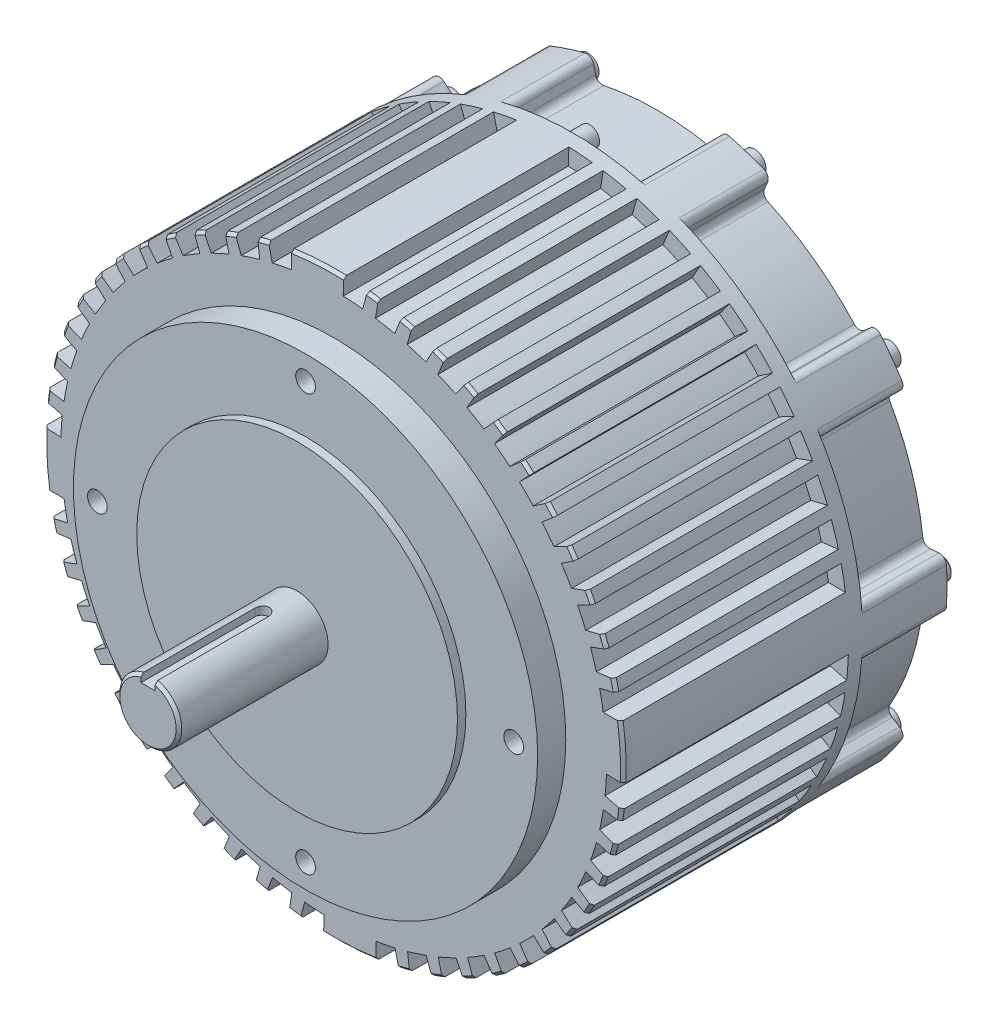
from build123d import *

# Parameters (mm, degrees)
CROQUIS1_W                        = 103
CROQUIS1_H                        = 115
CROQUIS2_R                        = 82.5
SALIENTE_EXTRUIR1_DEPTH           = 10
CROQUIS3_R                        = 57
SALIENTE_EXTRUIR2_DEPTH           = 3
CROQUIS4_R                        = 11
SALIENTE_EXTRUIR3_DEPTH           = 53
CORTAR_EXTRUIR1_START             = 8
CORTAR_EXTRUIR1_DEPTH             = 4
CORTAR_EXTRUIR2_START             = -30
CORTAR_EXTRUIR2_DEPTH             = 30
CROQUIS7_R                        = 3.5
SALIENTE_EXTRUIR4_DEPTH           = 6
CORTAR_EXTRUIR3_DEPTH             = 3
CORTAR_EXTRUIR4_START             = -30
CORTAR_EXTRUIR4_DEPTH             = 30
CROQUIS10_R                       = 3.5
SALIENTE_EXTRUIR5_DEPTH           = 6
CORTAR_EXTRUIR5_DEPTH             = 3
CROQUIS12_R                       = 4
SALIENTE_EXTRUIR6_DEPTH           = 5
CORTAR_EXTRUIR6_DEPTH             = 3
CROQUIS14_R                       = 4
SALIENTE_EXTRUIR7_DEPTH           = 5
CORTAR_EXTRUIR7_DEPTH             = 3
CROQUIS16_R                       = 4
SALIENTE_EXTRUIR8_DEPTH           = 5
CORTAR_EXTRUIR8_DEPTH             = 3
CROQUIS18_R                       = 4
SALIENTE_EXTRUIR9_DEPTH           = 5
CORTAR_EXTRUIR9_DEPTH             = 3
CROQUIS20_R                       = 4
SALIENTE_EXTRUIR10_DEPTH          = 5
CORTAR_EXTRUIR10_DEPTH            = 3
CROQUIS22_R                       = 4
SALIENTE_EXTRUIR11_DEPTH          = 5
CORTAR_EXTRUIR11_DEPTH            = 3
CROQUIS24_R                       = 4
SALIENTE_EXTRUIR12_DEPTH          = 5
CORTAR_EXTRUIR12_DEPTH            = 3
CROQUIS26_R                       = 4
SALIENTE_EXTRUIR13_DEPTH          = 5
CORTAR_EXTRUIR13_DEPTH            = 3
CROQUIS28_R                       = 4
SALIENTE_EXTRUIR14_DEPTH          = 5
CORTAR_EXTRUIR14_DEPTH            = 3
CORTAR_EXTRUIR15_DEPTH            = 80
CORTAR_EXTRUIR16_DEPTH            = 80
CORTAR_EXTRUIR17_DEPTH            = 80
CORTAR_EXTRUIR18_DEPTH            = 80
CORTAR_EXTRUIR19_DEPTH            = 80
CORTAR_EXTRUIR20_DEPTH            = 80
CORTAR_EXTRUIR21_DEPTH            = 80
CORTAR_EXTRUIR22_DEPTH            = 80
CORTAR_EXTRUIR23_DEPTH            = 80
CORTAR_EXTRUIR24_DEPTH            = 80
CORTAR_EXTRUIR25_DEPTH            = 80
CORTAR_EXTRUIR26_DEPTH            = 80
CORTAR_EXTRUIR27_DEPTH            = 80
CORTAR_EXTRUIR28_DEPTH            = 80
CORTAR_EXTRUIR29_DEPTH            = 80
CORTAR_EXTRUIR30_DEPTH            = 80
CORTAR_EXTRUIR31_DEPTH            = 80
CORTAR_EXTRUIR32_DEPTH            = 80
CORTAR_EXTRUIR33_DEPTH            = 80
CORTAR_EXTRUIR34_DEPTH            = 80
CORTAR_EXTRUIR35_DEPTH            = 80
CORTAR_EXTRUIR36_DEPTH            = 80
CORTAR_EXTRUIR37_DEPTH            = 80
CORTAR_EXTRUIR38_DEPTH            = 80
CORTAR_EXTRUIR39_DEPTH            = 80
CORTAR_EXTRUIR40_DEPTH            = 80
CORTAR_EXTRUIR41_DEPTH            = 80
CORTAR_EXTRUIR42_DEPTH            = 80
CORTAR_EXTRUIR43_DEPTH            = 80
CORTAR_EXTRUIR44_DEPTH            = 80
CORTAR_EXTRUIR45_DEPTH            = 80
CORTAR_EXTRUIR46_DEPTH            = 80
CORTAR_EXTRUIR47_DEPTH            = 80
CORTAR_EXTRUIR48_DEPTH            = 80
CORTAR_EXTRUIR49_DEPTH            = 80
CORTAR_EXTRUIR50_DEPTH            = 80
CORTAR_EXTRUIR51_DEPTH            = 80
CORTAR_EXTRUIR52_DEPTH            = 80
CORTAR_EXTRUIR53_DEPTH            = 80
CORTAR_EXTRUIR54_DEPTH            = 80
CORTAR_EXTRUIR55_DEPTH            = 80
CORTAR_EXTRUIR56_DEPTH            = 80
CORTAR_EXTRUIR57_DEPTH            = 80
CORTAR_EXTRUIR58_DEPTH            = 80
CORTAR_EXTRUIR59_DEPTH            = 80
CORTAR_EXTRUIR60_DEPTH            = 80
CORTAR_EXTRUIR61_DEPTH            = 80
CORTAR_EXTRUIR62_DEPTH            = 80
CORTAR_EXTRUIR63_START            = -30
CORTAR_EXTRUIR63_DEPTH            = 30
CORTAR_EXTRUIR64_START            = -30
CORTAR_EXTRUIR64_DEPTH            = 30
CORTAR_EXTRUIR65_START            = -30
CORTAR_EXTRUIR65_DEPTH            = 30
CORTAR_EXTRUIR66_START            = -30
CORTAR_EXTRUIR66_DEPTH            = 30
CORTAR_EXTRUIR67_START            = -30
CORTAR_EXTRUIR67_DEPTH            = 30
CORTAR_EXTRUIR68_START            = -30
CORTAR_EXTRUIR68_DEPTH            = 30
CORTAR_EXTRUIR69_START            = -30
CORTAR_EXTRUIR69_DEPTH            = 30
CORTAR_EXTRUIR70_START            = -30
CORTAR_EXTRUIR70_DEPTH            = 30
CROQUIS86_R                       = 4
SALIENTE_EXTRUIR15_DEPTH          = 5
CORTAR_EXTRUIR71_DEPTH            = 3
DI_METRO_DE_TALADRO_7_0_7_1_D     = 7
DI_METRO_DE_TALADRO_7_0_7_1_DEPTH = 21
DI_METRO_DE_TALADRO_7_0_7_1_TIP   = 2.103012167
CHAFL_N1_SIZE                     = 1
CHAFL_N2_SIZE                     = 0.5
REDONDEO1_R                       = 2.5


with BuildPart() as part:
    # Croquis1 → Revolución1 (revolve)
    with BuildSketch(Plane.XZ, mode=Mode.PRIVATE) as revoluci_n1_sk:
        with Locations((51.5, 57.5)):
            Rectangle(CROQUIS1_W, CROQUIS1_H)
    revolve(revoluci_n1_sk.sketch.rotate(Axis((0, 0, 115), (0, 0, -1)), 180), axis=Axis((0, 0, 115), (0, 0, -1)))

    # Croquis2 → Saliente-Extruir1 (add)
    with BuildSketch(Plane.XY.offset(115)):
        Circle(CROQUIS2_R)
    extrude(amount=SALIENTE_EXTRUIR1_DEPTH)

    # Croquis3 → Saliente-Extruir2 (add)
    with BuildSketch(Plane.XY.offset(125)):
        Circle(CROQUIS3_R)
    extrude(amount=SALIENTE_EXTRUIR2_DEPTH)

    # Croquis4 → Saliente-Extruir3 (add)
    with BuildSketch(Plane.XY.offset(128)):
        Circle(CROQUIS4_R)
    extrude(amount=SALIENTE_EXTRUIR3_DEPTH)

    # Cortar-Extruir1: read off the stored shape, not the designer's step
    # Cortar-Extruir1 outline → Cortar-Extruir1 (cut)
    with BuildSketch(Plane(origin=(0, 0, 0), x_dir=(1, 0, 0), z_dir=(0, 1, 0)).offset(CORTAR_EXTRUIR1_START)):
        with BuildLine():
            Line((-2.5, -181), (2.5, -181))
            Line((2.5, -181), (2.5, -140.5))
            ThreePointArc((2.5, -140.5), (0, -138), (-2.5, -140.5))
            Line((-2.5, -140.5), (-2.5, -181))
        make_face()
    extrude(amount=CORTAR_EXTRUIR1_DEPTH, mode=Mode.SUBTRACT)

    # Croquis6 → Cortar-Extruir2 (cut)
    with BuildSketch(Plane(origin=(0, 0, 0), x_dir=(-1, 0, 0), z_dir=(0, 0, -1)).offset(CORTAR_EXTRUIR2_START)):
        with BuildLine():
            Line((23.169958597, -100.360116673), (21.370350163, -92.565156155))
            ThreePointArc((21.370350163, -92.565156155), (0, -95), (-21.370350163, -92.565156155))
            Line((-21.370350163, -92.565156155), (-23.169958597, -100.360116673))
            ThreePointArc((-23.169958597, -100.360116673), (0, -103), (23.169958597, -100.360116673))
        make_face()
    extrude(amount=CORTAR_EXTRUIR2_DEPTH, mode=Mode.SUBTRACT)

    # Croquis7 → Saliente-Extruir4 (add)
    with BuildSketch(Plane(origin=(0, 0, 30), x_dir=(-1, 0, 0), z_dir=(0, 0, -1))):
        with Locations((0, -99)):
            Circle(CROQUIS7_R)
    extrude(amount=SALIENTE_EXTRUIR4_DEPTH)

    # Croquis8 → Cortar-Extruir3 (cut)
    with BuildSketch(Plane(origin=(0, 0, 24), x_dir=(-1, 0, 0), z_dir=(0, 0, -1))):
        Polygon((-1.933077268, -100.116062681), (0, -101.232125362), (1.933077268, -100.116062681), (1.933077268, -97.883937319), (0, -96.767874638), (-1.933077268, -97.883937319), align=None)
    extrude(amount=-CORTAR_EXTRUIR3_DEPTH, mode=Mode.SUBTRACT)

    # Croquis9 → Cortar-Extruir4 (cut)
    with BuildSketch(Plane(origin=(0, 0, 0), x_dir=(-1, 0, 0), z_dir=(0, 0, -1)).offset(CORTAR_EXTRUIR4_START)):
        with BuildLine():
            Line((-23.169958597, 100.360116673), (-21.370350163, 92.565156155))
            ThreePointArc((-21.370350163, 92.565156155), (0, 95), (21.370350163, 92.565156155))
            Line((21.370350163, 92.565156155), (23.169958597, 100.360116673))
            ThreePointArc((23.169958597, 100.360116673), (0, 103), (-23.169958597, 100.360116673))
        make_face()
    extrude(amount=CORTAR_EXTRUIR4_DEPTH, mode=Mode.SUBTRACT)

    # Croquis10 → Saliente-Extruir5 (add)
    with BuildSketch(Plane(origin=(0, 0, 30), x_dir=(-1, 0, 0), z_dir=(0, 0, -1))):
        with Locations((0, 99)):
            Circle(CROQUIS10_R)
    extrude(amount=SALIENTE_EXTRUIR5_DEPTH)

    # Croquis11 → Cortar-Extruir5 (cut)
    with BuildSketch(Plane(origin=(0, 0, 24), x_dir=(-1, 0, 0), z_dir=(0, 0, -1))):
        Polygon((0, 101.232125362), (-1.933077268, 100.116062681), (-1.933077268, 97.883937319), (0, 96.767874638), (1.933077268, 97.883937319), (1.933077268, 100.116062681), align=None)
    extrude(amount=-CORTAR_EXTRUIR5_DEPTH, mode=Mode.SUBTRACT)

    # Croquis12 → Saliente-Extruir6 (add)
    with BuildSketch(Plane(origin=(0, 0, 0), x_dir=(-1, 0, 0), z_dir=(0, 0, -1))):
        with Locations((-96, 0)):
            Circle(CROQUIS12_R)
    extrude(amount=SALIENTE_EXTRUIR6_DEPTH)

    # Croquis13 → Cortar-Extruir6 (cut)
    with BuildSketch(Plane(origin=(0, 0, -5), x_dir=(-1, 0, 0), z_dir=(0, 0, -1))):
        Polygon((-96.912059498, -2.738883131), (-94.08408738, -2.159308261), (-93.172027882, 0.57957487), (-95.087940502, 2.738883131), (-97.91591262, 2.159308261), (-98.827972118, -0.57957487), align=None)
    extrude(amount=-CORTAR_EXTRUIR6_DEPTH, mode=Mode.SUBTRACT)

    # Croquis14 → Saliente-Extruir7 (add)
    with BuildSketch(Plane(origin=(0, 0, 0), x_dir=(-1, 0, 0), z_dir=(0, 0, -1))):
        with Locations((-77.66563146, 56.42738422)):
            Circle(CROQUIS14_R)
    extrude(amount=SALIENTE_EXTRUIR7_DEPTH)

    # Croquis15 → Cortar-Extruir7 (cut)
    with BuildSketch(Plane(origin=(0, 0, -5), x_dir=(-1, 0, 0), z_dir=(0, 0, -1))):
        Polygon((-80.013378206, 54.747676344), (-77.384835141, 53.554321958), (-75.037088395, 55.234029835), (-75.317884714, 58.107092096), (-77.946427779, 59.300446482), (-80.294174525, 57.620738606), align=None)
    extrude(amount=-CORTAR_EXTRUIR7_DEPTH, mode=Mode.SUBTRACT)

    # Croquis16 → Saliente-Extruir8 (add)
    with BuildSketch(Plane(origin=(0, 0, 0), x_dir=(-1, 0, 0), z_dir=(0, 0, -1))):
        with Locations((-29.66563146, 91.301425564)):
            Circle(CROQUIS16_R)
    extrude(amount=SALIENTE_EXTRUIR8_DEPTH)

    # Croquis17 → Cortar-Extruir8 (cut)
    with BuildSketch(Plane(origin=(0, 0, -5), x_dir=(-1, 0, 0), z_dir=(0, 0, -1))):
        Polygon((-32.552305994, 91.32248426), (-31.127206093, 88.812021433), (-28.240531559, 88.790962738), (-26.778956926, 91.280366868), (-28.204056827, 93.790829695), (-31.090731361, 93.811888391), align=None)
    extrude(amount=-CORTAR_EXTRUIR8_DEPTH, mode=Mode.SUBTRACT)

    # Croquis18 → Saliente-Extruir9 (add)
    with BuildSketch(Plane(origin=(0, 0, 0), x_dir=(-1, 0, 0), z_dir=(0, 0, -1))):
        with Locations((29.66563146, 91.301425564)):
            Circle(CROQUIS18_R)
    extrude(amount=SALIENTE_EXTRUIR9_DEPTH)

    # Croquis19 → Cortar-Extruir9 (cut)
    with BuildSketch(Plane(origin=(0, 0, -5), x_dir=(-1, 0, 0), z_dir=(0, 0, -1))):
        Polygon((27.342640696, 93.015207126), (27.019957709, 90.146547331), (29.342948473, 88.432765769), (31.988622224, 89.587644002), (32.311305211, 92.456303798), (29.988314447, 94.17008536), align=None)
    extrude(amount=-CORTAR_EXTRUIR9_DEPTH, mode=Mode.SUBTRACT)

    # Croquis20 → Saliente-Extruir10 (add)
    with BuildSketch(Plane(origin=(0, 0, 0), x_dir=(-1, 0, 0), z_dir=(0, 0, -1))):
        with Locations((77.66563146, 56.42738422)):
            Circle(CROQUIS20_R)
    extrude(amount=SALIENTE_EXTRUIR10_DEPTH)

    # Croquis21 → Cortar-Extruir10 (cut)
    with BuildSketch(Plane(origin=(0, 0, -5), x_dir=(-1, 0, 0), z_dir=(0, 0, -1))):
        Polygon((76.793627982, 59.179282341), (74.84641604, 57.048156116), (75.718419518, 54.296257995), (78.537634938, 53.675486099), (80.48484688, 55.806612324), (79.612843402, 58.558510445), align=None)
    extrude(amount=-CORTAR_EXTRUIR10_DEPTH, mode=Mode.SUBTRACT)

    # Croquis22 → Saliente-Extruir11 (add)
    with BuildSketch(Plane(origin=(0, 0, 0), x_dir=(-1, 0, 0), z_dir=(0, 0, -1))):
        with Locations((96, 0)):
            Circle(CROQUIS22_R)
    extrude(amount=SALIENTE_EXTRUIR11_DEPTH)

    # Croquis23 → Cortar-Extruir11 (cut)
    with BuildSketch(Plane(origin=(0, 0, -5), x_dir=(-1, 0, 0), z_dir=(0, 0, -1))):
        Polygon((96.912059498, 2.738883131), (94.08408738, 2.159308261), (93.172027882, -0.57957487), (95.087940502, -2.738883131), (97.91591262, -2.159308261), (98.827972118, 0.57957487), align=None)
    extrude(amount=-CORTAR_EXTRUIR11_DEPTH, mode=Mode.SUBTRACT)

    # Croquis24 → Saliente-Extruir12 (add)
    with BuildSketch(Plane(origin=(0, 0, 0), x_dir=(-1, 0, 0), z_dir=(0, 0, -1))):
        with Locations((77.66563146, -56.42738422)):
            Circle(CROQUIS24_R)
    extrude(amount=SALIENTE_EXTRUIR12_DEPTH)

    # Croquis25 → Cortar-Extruir12 (cut)
    with BuildSketch(Plane(origin=(0, 0, -5), x_dir=(-1, 0, 0), z_dir=(0, 0, -1))):
        Polygon((80.013378206, -54.747676344), (77.384835141, -53.554321958), (75.037088395, -55.234029835), (75.317884714, -58.107092096), (77.946427779, -59.300446482), (80.294174525, -57.620738606), align=None)
    extrude(amount=-CORTAR_EXTRUIR12_DEPTH, mode=Mode.SUBTRACT)

    # Croquis26 → Saliente-Extruir13 (add)
    with BuildSketch(Plane(origin=(0, 0, 0), x_dir=(-1, 0, 0), z_dir=(0, 0, -1))):
        with Locations((29.66563146, -91.301425564)):
            Circle(CROQUIS26_R)
    extrude(amount=SALIENTE_EXTRUIR13_DEPTH)

    # Croquis27 → Cortar-Extruir13 (cut)
    with BuildSketch(Plane(origin=(0, 0, -5), x_dir=(-1, 0, 0), z_dir=(0, 0, -1))):
        Polygon((32.552305994, -91.32248426), (31.127206093, -88.812021433), (28.240531559, -88.790962738), (26.778956926, -91.280366868), (28.204056827, -93.790829695), (31.090731361, -93.811888391), align=None)
    extrude(amount=-CORTAR_EXTRUIR13_DEPTH, mode=Mode.SUBTRACT)

    # Croquis28 → Saliente-Extruir14 (add)
    with BuildSketch(Plane(origin=(0, 0, 0), x_dir=(-1, 0, 0), z_dir=(0, 0, -1))):
        with Locations((-29.66563146, -91.301425564)):
            Circle(CROQUIS28_R)
    extrude(amount=SALIENTE_EXTRUIR14_DEPTH)

    # Croquis29 → Cortar-Extruir14 (cut)
    with BuildSketch(Plane(origin=(0, 0, -5), x_dir=(-1, 0, 0), z_dir=(0, 0, -1))):
        Polygon((-27.342640696, -93.015207126), (-27.019957709, -90.146547331), (-29.342948473, -88.432765769), (-31.988622224, -89.587644002), (-32.311305211, -92.456303798), (-29.988314447, -94.17008536), align=None)
    extrude(amount=-CORTAR_EXTRUIR14_DEPTH, mode=Mode.SUBTRACT)

    # Croquis30 → Cortar-Extruir15 (cut)
    with BuildSketch(Plane.XY.offset(115)):
        with BuildLine():
            Line((102.937255183, -3.59464816), (96.940910221, -3.38525118))
            ThreePointArc((96.940910221, -3.38525118), (96.757524291, -6.854304707), (96.450037373, -10.314566918))
            Line((96.450037373, -10.314566918), (102.311975793, -11.885268584))
            ThreePointArc((102.311975793, -11.885268584), (102.708302005, -7.746270017), (102.937255183, -3.59464816))
        make_face()
    extrude(amount=-CORTAR_EXTRUIR15_DEPTH, mode=Mode.SUBTRACT)

    # Croquis31 → Cortar-Extruir16 (cut)
    with BuildSketch(Plane.XY.offset(115)):
        with BuildLine():
            Line((101.782517783, -15.789840842), (95.853439077, -14.870044288))
            ThreePointArc((95.853439077, -14.870044288), (95.259507291, -18.292792863), (94.543395869, -21.692079141))
            Line((94.543395869, -21.692079141), (100.177405755, -23.947596458))
            ThreePointArc((100.177405755, -23.947596458), (101.062307133, -19.884920843), (101.782517783, -15.789840842))
        make_face()
    extrude(amount=-CORTAR_EXTRUIR16_DEPTH, mode=Mode.SUBTRACT)

    # Croquis32 → Cortar-Extruir17 (cut)
    with BuildSketch(Plane.XY.offset(115)):
        with BuildLine():
            Line((99.188144974, -27.761698372), (93.410194782, -26.14451206))
            ThreePointArc((93.410194782, -26.14451206), (92.414117847, -29.472543537), (91.299510768, -32.762773594))
            Line((91.299510768, -32.762773594), (96.625903384, -35.671204005))
            ThreePointArc((96.625903384, -35.671204005), (97.986863678, -31.742314763), (99.188144974, -27.761698372))
        make_face()
    extrude(amount=-CORTAR_EXTRUIR17_DEPTH, mode=Mode.SUBTRACT)

    # Croquis33 → Cortar-Extruir18 (cut)
    with BuildSketch(Plane.XY.offset(115)):
        with BuildLine():
            Line((95.190832166, -39.340888038), (89.645735146, -37.049185822))
            ThreePointArc((89.645735146, -37.049185822), (88.261601805, -40.235427757), (86.764264327, -43.37006382))
            Line((86.764264327, -43.37006382), (91.707701949, -46.890269815))
            ThreePointArc((91.707701949, -46.890269815), (93.525471423, -43.150738061), (95.190832166, -39.340888038))
        make_face()
    extrude(amount=-CORTAR_EXTRUIR18_DEPTH, mode=Mode.SUBTRACT)

    # Croquis34 → Cortar-Extruir19 (cut)
    with BuildSketch(Plane.XY.offset(115)):
        with BuildLine():
            Line((89.847118271, -50.363631109), (84.613305556, -47.429827355))
            ThreePointArc((84.613305556, -47.429827355), (82.860693309, -50.429212807), (81.001804119, -53.36391786))
            Line((81.001804119, -53.36391786), (85.492365624, -57.446108833))
            ThreePointArc((85.492365624, -57.446108833), (87.741233327, -53.948827367), (89.847118271, -50.363631109))
        make_face()
    extrude(amount=-CORTAR_EXTRUIR19_DEPTH, mode=Mode.SUBTRACT)

    # Croquis35 → Cortar-Extruir20 (cut)
    with BuildSketch(Plane.XY.offset(115)):
        with BuildLine():
            Line((83.232586011, -60.674019365), (78.384085855, -57.13961047))
            ThreePointArc((78.384085855, -57.13961047), (76.287784055, -59.909715439), (74.093635711, -62.602980337))
            Line((74.093635711, -62.602980337), (78.067805561, -67.189416837))
            ThreePointArc((78.067805561, -67.189416837), (80.71596299, -63.983852015), (83.232586011, -60.674019365))
        make_face()
    extrude(amount=-CORTAR_EXTRUIR20_DEPTH, mode=Mode.SUBTRACT)

    # Croquis36 → Cortar-Extruir21 (cut)
    with BuildSketch(Plane.XY.offset(115)):
        with BuildLine():
            Line((75.440792857, -70.126220297), (71.046183565, -66.041197755))
            ThreePointArc((71.046183565, -66.041197755), (68.635842788, -68.542841237), (66.137469829, -70.956571821))
            Line((66.137469829, -70.956571821), (69.539036449, -75.982382232))
            ThreePointArc((69.539036449, -75.982382232), (72.549027454, -73.113874302), (75.440792857, -70.126220297))
        make_face()
    extrude(amount=-CORTAR_EXTRUIR21_DEPTH, mode=Mode.SUBTRACT)

    # Croquis37 → Cortar-Extruir22 (cut)
    with BuildSketch(Plane.XY.offset(115)):
        with BuildLine():
            Line((66.581947728, -78.586539793), (62.703387667, -74.008683106))
            ThreePointArc((62.703387667, -74.008683106), (60.013100328, -76.206481279), (57.245840319, -78.306537187))
            Line((57.245840319, -78.306537187), (60.026691167, -83.700635288))
            ThreePointArc((60.026691167, -83.700635288), (63.355941741, -81.209757087), (66.581947728, -78.586539793))
        make_face()
    extrude(amount=-CORTAR_EXTRUIR22_DEPTH, mode=Mode.SUBTRACT)

    # Croquis38 → Cortar-Extruir23 (cut)
    with BuildSketch(Plane.XY.offset(115)):
        with BuildLine():
            Line((56.781352174, -85.935313145), (53.473700591, -80.929372573))
            ThreePointArc((53.473700591, -80.929372573), (50.541518736, -82.792239273), (47.54451244, -84.548916829))
            Line((47.54451244, -84.548916829), (49.665314519, -90.235007252))
            ThreePointArc((49.665314519, -90.235007252), (53.266734974, -88.156990336), (56.781352174, -85.935313145))
        make_face()
    extrude(amount=-CORTAR_EXTRUIR23_DEPTH, mode=Mode.SUBTRACT)

    # Croquis39 → Cortar-Extruir24 (cut)
    with BuildSketch(Plane.XY.offset(115)):
        with BuildLine():
            Line((46.177628077, -92.068597606), (43.48766916, -86.705378328))
            ThreePointArc((43.48766916, -86.705378328), (40.355066245, -88.206964739), (37.17070401, -89.595417089))
            Line((37.17070401, -89.595417089), (38.601460207, -95.49307446))
            ThreePointArc((38.601460207, -95.49307446), (42.424111222, -93.857310781), (46.177628077, -92.068597606))
        make_face()
    extrude(amount=-CORTAR_EXTRUIR24_DEPTH, mode=Mode.SUBTRACT)

    # Croquis40 → Cortar-Extruir25 (cut)
    with BuildSketch(Plane.XY.offset(115)):
        with BuildLine():
            Line((34.920756958, -96.899642587), (32.886538106, -91.255003213))
            ThreePointArc((32.886538106, -91.255003213), (29.597822388, -92.374070549), (26.271144569, -93.374659105))
            Line((26.271144569, -93.374659105), (26.991617938, -99.400465598))
            ThreePointArc((26.991617938, -99.400465598), (30.981431056, -98.230091773), (34.920756958, -96.899642587))
        make_face()
    extrude(amount=-CORTAR_EXTRUIR25_DEPTH, mode=Mode.SUBTRACT)

    # Croquis41 → Cortar-Extruir26 (cut)
    with BuildSketch(Plane.XY.offset(115)):
        with BuildLine():
            Line((23.169958597, -100.360116673), (21.820252271, -94.513896284))
            ThreePointArc((21.820252271, -94.513896284), (18.421940106, -95.2346162), (15, -95.833188406))
            Line((15, -95.833188406), (15, -101.901913623))
            ThreePointArc((15, -101.901913623), (19.100542382, -101.21348369), (23.169958597, -100.360116673))
        make_face()
    extrude(amount=-CORTAR_EXTRUIR26_DEPTH, mode=Mode.SUBTRACT)

    # Croquis42 → Cortar-Extruir27 (cut)
    with BuildSketch(Plane.XY.offset(115)):
        with BuildLine():
            Line((-3.59464816, -102.937255183), (-3.38525118, -96.940910221))
            ThreePointArc((-3.38525118, -96.940910221), (-6.854304707, -96.757524291), (-10.314566918, -96.450037373))
            Line((-10.314566918, -96.450037373), (-11.885268584, -102.311975793))
            ThreePointArc((-11.885268584, -102.311975793), (-7.746270017, -102.708302005), (-3.59464816, -102.937255183))
        make_face()
    extrude(amount=-CORTAR_EXTRUIR27_DEPTH, mode=Mode.SUBTRACT)

    # Croquis43 → Cortar-Extruir28 (cut)
    with BuildSketch(Plane.XY.offset(115)):
        with BuildLine():
            Line((-15.789840842, -101.782517783), (-14.870044288, -95.853439077))
            ThreePointArc((-14.870044288, -95.853439077), (-18.292792863, -95.259507291), (-21.692079141, -94.543395869))
            Line((-21.692079141, -94.543395869), (-23.947596458, -100.177405755))
            ThreePointArc((-23.947596458, -100.177405755), (-19.884920843, -101.062307133), (-15.789840842, -101.782517783))
        make_face()
    extrude(amount=-CORTAR_EXTRUIR28_DEPTH, mode=Mode.SUBTRACT)

    # Croquis44 → Cortar-Extruir29 (cut)
    with BuildSketch(Plane.XY.offset(115)):
        with BuildLine():
            Line((-27.761698372, -99.188144974), (-26.14451206, -93.410194782))
            ThreePointArc((-26.14451206, -93.410194782), (-29.472543537, -92.414117847), (-32.762773594, -91.299510768))
            Line((-32.762773594, -91.299510768), (-35.671204005, -96.625903384))
            ThreePointArc((-35.671204005, -96.625903384), (-31.742314763, -97.986863678), (-27.761698372, -99.188144974))
        make_face()
    extrude(amount=-CORTAR_EXTRUIR29_DEPTH, mode=Mode.SUBTRACT)

    # Croquis45 → Cortar-Extruir30 (cut)
    with BuildSketch(Plane.XY.offset(115)):
        with BuildLine():
            Line((-39.340888038, -95.190832166), (-37.049185822, -89.645735146))
            ThreePointArc((-37.049185822, -89.645735146), (-40.235427757, -88.261601805), (-43.37006382, -86.764264327))
            Line((-43.37006382, -86.764264327), (-46.890269815, -91.707701949))
            ThreePointArc((-46.890269815, -91.707701949), (-43.150738061, -93.525471423), (-39.340888038, -95.190832166))
        make_face()
    extrude(amount=-CORTAR_EXTRUIR30_DEPTH, mode=Mode.SUBTRACT)

    # Croquis46 → Cortar-Extruir31 (cut)
    with BuildSketch(Plane.XY.offset(115)):
        with BuildLine():
            Line((-50.363631109, -89.847118271), (-47.429827355, -84.613305556))
            ThreePointArc((-47.429827355, -84.613305556), (-50.429212807, -82.860693309), (-53.36391786, -81.001804119))
            Line((-53.36391786, -81.001804119), (-57.446108833, -85.492365624))
            ThreePointArc((-57.446108833, -85.492365624), (-53.948827367, -87.741233327), (-50.363631109, -89.847118271))
        make_face()
    extrude(amount=-CORTAR_EXTRUIR31_DEPTH, mode=Mode.SUBTRACT)

    # Croquis47 → Cortar-Extruir32 (cut)
    with BuildSketch(Plane.XY.offset(115)):
        with BuildLine():
            Line((-60.674019365, -83.232586011), (-57.13961047, -78.384085855))
            ThreePointArc((-57.13961047, -78.384085855), (-59.909715439, -76.287784055), (-62.602980337, -74.093635711))
            Line((-62.602980337, -74.093635711), (-67.189416837, -78.067805561))
            ThreePointArc((-67.189416837, -78.067805561), (-63.983852015, -80.71596299), (-60.674019365, -83.232586011))
        make_face()
    extrude(amount=-CORTAR_EXTRUIR32_DEPTH, mode=Mode.SUBTRACT)

    # Croquis48 → Cortar-Extruir33 (cut)
    with BuildSketch(Plane.XY.offset(115)):
        with BuildLine():
            Line((-70.126220297, -75.440792857), (-66.041197755, -71.046183565))
            ThreePointArc((-66.041197755, -71.046183565), (-68.542841237, -68.635842788), (-70.956571821, -66.137469829))
            Line((-70.956571821, -66.137469829), (-75.982382232, -69.539036449))
            ThreePointArc((-75.982382232, -69.539036449), (-73.113874302, -72.549027454), (-70.126220297, -75.440792857))
        make_face()
    extrude(amount=-CORTAR_EXTRUIR33_DEPTH, mode=Mode.SUBTRACT)

    # Croquis49 → Cortar-Extruir34 (cut)
    with BuildSketch(Plane.XY.offset(115)):
        with BuildLine():
            Line((-78.586539793, -66.581947728), (-74.008683106, -62.703387667))
            ThreePointArc((-74.008683106, -62.703387667), (-76.206481279, -60.013100328), (-78.306537187, -57.245840319))
            Line((-78.306537187, -57.245840319), (-83.700635288, -60.026691167))
            ThreePointArc((-83.700635288, -60.026691167), (-81.209757087, -63.355941741), (-78.586539793, -66.581947728))
        make_face()
    extrude(amount=-CORTAR_EXTRUIR34_DEPTH, mode=Mode.SUBTRACT)

    # Croquis50 → Cortar-Extruir35 (cut)
    with BuildSketch(Plane.XY.offset(115)):
        with BuildLine():
            Line((-85.935313145, -56.781352174), (-80.929372573, -53.473700591))
            ThreePointArc((-80.929372573, -53.473700591), (-82.792239273, -50.541518736), (-84.548916829, -47.54451244))
            Line((-84.548916829, -47.54451244), (-90.235007252, -49.665314519))
            ThreePointArc((-90.235007252, -49.665314519), (-88.156990336, -53.266734974), (-85.935313145, -56.781352174))
        make_face()
    extrude(amount=-CORTAR_EXTRUIR35_DEPTH, mode=Mode.SUBTRACT)

    # Croquis51 → Cortar-Extruir36 (cut)
    with BuildSketch(Plane.XY.offset(115)):
        with BuildLine():
            Line((-92.068597606, -46.177628077), (-86.705378328, -43.48766916))
            ThreePointArc((-86.705378328, -43.48766916), (-88.206964739, -40.355066245), (-89.595417089, -37.17070401))
            Line((-89.595417089, -37.17070401), (-95.49307446, -38.601460207))
            ThreePointArc((-95.49307446, -38.601460207), (-93.857310781, -42.424111222), (-92.068597606, -46.177628077))
        make_face()
    extrude(amount=-CORTAR_EXTRUIR36_DEPTH, mode=Mode.SUBTRACT)

    # Croquis52 → Cortar-Extruir37 (cut)
    with BuildSketch(Plane.XY.offset(115)):
        with BuildLine():
            Line((-96.899642587, -34.920756958), (-91.255003213, -32.886538106))
            ThreePointArc((-91.255003213, -32.886538106), (-92.374070549, -29.597822388), (-93.374659105, -26.271144569))
            Line((-93.374659105, -26.271144569), (-99.400465598, -26.991617938))
            ThreePointArc((-99.400465598, -26.991617938), (-98.230091773, -30.981431056), (-96.899642587, -34.920756958))
        make_face()
    extrude(amount=-CORTAR_EXTRUIR37_DEPTH, mode=Mode.SUBTRACT)

    # Croquis53 → Cortar-Extruir38 (cut)
    with BuildSketch(Plane.XY.offset(115)):
        with BuildLine():
            Line((-100.360116673, -23.169958597), (-94.513896284, -21.820252271))
            ThreePointArc((-94.513896284, -21.820252271), (-95.2346162, -18.421940106), (-95.833188406, -15))
            Line((-95.833188406, -15), (-101.901913623, -15))
            ThreePointArc((-101.901913623, -15), (-101.21348369, -19.100542382), (-100.360116673, -23.169958597))
        make_face()
    extrude(amount=-CORTAR_EXTRUIR38_DEPTH, mode=Mode.SUBTRACT)

    # Croquis54 → Cortar-Extruir39 (cut)
    with BuildSketch(Plane.XY.offset(115)):
        with BuildLine():
            Line((-102.937255183, 3.59464816), (-96.940910221, 3.38525118))
            ThreePointArc((-96.940910221, 3.38525118), (-96.757524291, 6.854304707), (-96.450037373, 10.314566918))
            Line((-96.450037373, 10.314566918), (-102.311975793, 11.885268584))
            ThreePointArc((-102.311975793, 11.885268584), (-102.708302005, 7.746270017), (-102.937255183, 3.59464816))
        make_face()
    extrude(amount=-CORTAR_EXTRUIR39_DEPTH, mode=Mode.SUBTRACT)

    # Croquis55 → Cortar-Extruir40 (cut)
    with BuildSketch(Plane.XY.offset(115)):
        with BuildLine():
            Line((-101.782517783, 15.789840842), (-95.853439077, 14.870044288))
            ThreePointArc((-95.853439077, 14.870044288), (-95.259507291, 18.292792863), (-94.543395869, 21.692079141))
            Line((-94.543395869, 21.692079141), (-100.177405755, 23.947596458))
            ThreePointArc((-100.177405755, 23.947596458), (-101.062307133, 19.884920843), (-101.782517783, 15.789840842))
        make_face()
    extrude(amount=-CORTAR_EXTRUIR40_DEPTH, mode=Mode.SUBTRACT)

    # Croquis56 → Cortar-Extruir41 (cut)
    with BuildSketch(Plane.XY.offset(115)):
        with BuildLine():
            Line((-99.188144974, 27.761698372), (-93.410194782, 26.14451206))
            ThreePointArc((-93.410194782, 26.14451206), (-92.414117847, 29.472543537), (-91.299510768, 32.762773594))
            Line((-91.299510768, 32.762773594), (-96.625903384, 35.671204005))
            ThreePointArc((-96.625903384, 35.671204005), (-97.986863678, 31.742314763), (-99.188144974, 27.761698372))
        make_face()
    extrude(amount=-CORTAR_EXTRUIR41_DEPTH, mode=Mode.SUBTRACT)

    # Croquis57 → Cortar-Extruir42 (cut)
    with BuildSketch(Plane.XY.offset(115)):
        with BuildLine():
            Line((-95.190832166, 39.340888038), (-89.645735146, 37.049185822))
            ThreePointArc((-89.645735146, 37.049185822), (-88.261601805, 40.235427757), (-86.764264327, 43.37006382))
            Line((-86.764264327, 43.37006382), (-91.707701949, 46.890269815))
            ThreePointArc((-91.707701949, 46.890269815), (-93.525471423, 43.150738061), (-95.190832166, 39.340888038))
        make_face()
    extrude(amount=-CORTAR_EXTRUIR42_DEPTH, mode=Mode.SUBTRACT)

    # Croquis58 → Cortar-Extruir43 (cut)
    with BuildSketch(Plane.XY.offset(115)):
        with BuildLine():
            Line((-89.847118271, 50.363631109), (-84.613305556, 47.429827355))
            ThreePointArc((-84.613305556, 47.429827355), (-82.860693309, 50.429212807), (-81.001804119, 53.36391786))
            Line((-81.001804119, 53.36391786), (-85.492365624, 57.446108833))
            ThreePointArc((-85.492365624, 57.446108833), (-87.741233327, 53.948827367), (-89.847118271, 50.363631109))
        make_face()
    extrude(amount=-CORTAR_EXTRUIR43_DEPTH, mode=Mode.SUBTRACT)

    # Croquis59 → Cortar-Extruir44 (cut)
    with BuildSketch(Plane.XY.offset(115)):
        with BuildLine():
            Line((-83.232586011, 60.674019365), (-78.384085855, 57.13961047))
            ThreePointArc((-78.384085855, 57.13961047), (-76.287784055, 59.909715439), (-74.093635711, 62.602980337))
            Line((-74.093635711, 62.602980337), (-78.067805561, 67.189416837))
            ThreePointArc((-78.067805561, 67.189416837), (-80.71596299, 63.983852015), (-83.232586011, 60.674019365))
        make_face()
    extrude(amount=-CORTAR_EXTRUIR44_DEPTH, mode=Mode.SUBTRACT)

    # Croquis60 → Cortar-Extruir45 (cut)
    with BuildSketch(Plane.XY.offset(115)):
        with BuildLine():
            Line((-75.440792857, 70.126220297), (-71.046183565, 66.041197755))
            ThreePointArc((-71.046183565, 66.041197755), (-68.635842788, 68.542841237), (-66.137469829, 70.956571821))
            Line((-66.137469829, 70.956571821), (-69.539036449, 75.982382232))
            ThreePointArc((-69.539036449, 75.982382232), (-72.549027454, 73.113874302), (-75.440792857, 70.126220297))
        make_face()
    extrude(amount=-CORTAR_EXTRUIR45_DEPTH, mode=Mode.SUBTRACT)

    # Croquis61 → Cortar-Extruir46 (cut)
    with BuildSketch(Plane.XY.offset(115)):
        with BuildLine():
            Line((-66.581947728, 78.586539793), (-62.703387667, 74.008683106))
            ThreePointArc((-62.703387667, 74.008683106), (-60.013100328, 76.206481279), (-57.245840319, 78.306537187))
            Line((-57.245840319, 78.306537187), (-60.026691167, 83.700635288))
            ThreePointArc((-60.026691167, 83.700635288), (-63.355941741, 81.209757087), (-66.581947728, 78.586539793))
        make_face()
    extrude(amount=-CORTAR_EXTRUIR46_DEPTH, mode=Mode.SUBTRACT)

    # Croquis62 → Cortar-Extruir47 (cut)
    with BuildSketch(Plane.XY.offset(115)):
        with BuildLine():
            Line((-56.781352174, 85.935313145), (-53.473700591, 80.929372573))
            ThreePointArc((-53.473700591, 80.929372573), (-50.541518736, 82.792239273), (-47.54451244, 84.548916829))
            Line((-47.54451244, 84.548916829), (-49.665314519, 90.235007252))
            ThreePointArc((-49.665314519, 90.235007252), (-53.266734974, 88.156990336), (-56.781352174, 85.935313145))
        make_face()
    extrude(amount=-CORTAR_EXTRUIR47_DEPTH, mode=Mode.SUBTRACT)

    # Croquis63 → Cortar-Extruir48 (cut)
    with BuildSketch(Plane.XY.offset(115)):
        with BuildLine():
            Line((-46.177628077, 92.068597606), (-43.48766916, 86.705378328))
            ThreePointArc((-43.48766916, 86.705378328), (-40.355066245, 88.206964739), (-37.17070401, 89.595417089))
            Line((-37.17070401, 89.595417089), (-38.601460207, 95.49307446))
            ThreePointArc((-38.601460207, 95.49307446), (-42.424111222, 93.857310781), (-46.177628077, 92.068597606))
        make_face()
    extrude(amount=-CORTAR_EXTRUIR48_DEPTH, mode=Mode.SUBTRACT)

    # Croquis64 → Cortar-Extruir49 (cut)
    with BuildSketch(Plane.XY.offset(115)):
        with BuildLine():
            Line((-34.920756958, 96.899642587), (-32.886538106, 91.255003213))
            ThreePointArc((-32.886538106, 91.255003213), (-29.597822388, 92.374070549), (-26.271144569, 93.374659105))
            Line((-26.271144569, 93.374659105), (-26.991617938, 99.400465598))
            ThreePointArc((-26.991617938, 99.400465598), (-30.981431056, 98.230091773), (-34.920756958, 96.899642587))
        make_face()
    extrude(amount=-CORTAR_EXTRUIR49_DEPTH, mode=Mode.SUBTRACT)

    # Croquis65 → Cortar-Extruir50 (cut)
    with BuildSketch(Plane.XY.offset(115)):
        with BuildLine():
            Line((-23.169958597, 100.360116673), (-21.820252271, 94.513896284))
            ThreePointArc((-21.820252271, 94.513896284), (-18.421940106, 95.2346162), (-15, 95.833188406))
            Line((-15, 95.833188406), (-15, 101.901913623))
            ThreePointArc((-15, 101.901913623), (-19.100542382, 101.21348369), (-23.169958597, 100.360116673))
        make_face()
    extrude(amount=-CORTAR_EXTRUIR50_DEPTH, mode=Mode.SUBTRACT)

    # Croquis66 → Cortar-Extruir51 (cut)
    with BuildSketch(Plane.XY.offset(115)):
        with BuildLine():
            Line((3.59464816, 102.937255183), (3.38525118, 96.940910221))
            ThreePointArc((3.38525118, 96.940910221), (6.854304707, 96.757524291), (10.314566918, 96.450037373))
            Line((10.314566918, 96.450037373), (11.885268584, 102.311975793))
            ThreePointArc((11.885268584, 102.311975793), (7.746270017, 102.708302005), (3.59464816, 102.937255183))
        make_face()
    extrude(amount=-CORTAR_EXTRUIR51_DEPTH, mode=Mode.SUBTRACT)

    # Croquis67 → Cortar-Extruir52 (cut)
    with BuildSketch(Plane.XY.offset(115)):
        with BuildLine():
            Line((15.789840842, 101.782517783), (14.870044288, 95.853439077))
            ThreePointArc((14.870044288, 95.853439077), (18.292792863, 95.259507291), (21.692079141, 94.543395869))
            Line((21.692079141, 94.543395869), (23.947596458, 100.177405755))
            ThreePointArc((23.947596458, 100.177405755), (19.884920843, 101.062307133), (15.789840842, 101.782517783))
        make_face()
    extrude(amount=-CORTAR_EXTRUIR52_DEPTH, mode=Mode.SUBTRACT)

    # Croquis68 → Cortar-Extruir53 (cut)
    with BuildSketch(Plane.XY.offset(115)):
        with BuildLine():
            Line((27.761698372, 99.188144974), (26.14451206, 93.410194782))
            ThreePointArc((26.14451206, 93.410194782), (29.472543537, 92.414117847), (32.762773594, 91.299510768))
            Line((32.762773594, 91.299510768), (35.671204005, 96.625903384))
            ThreePointArc((35.671204005, 96.625903384), (31.742314763, 97.986863678), (27.761698372, 99.188144974))
        make_face()
    extrude(amount=-CORTAR_EXTRUIR53_DEPTH, mode=Mode.SUBTRACT)

    # Croquis69 → Cortar-Extruir54 (cut)
    with BuildSketch(Plane.XY.offset(115)):
        with BuildLine():
            Line((39.340888038, 95.190832166), (37.049185822, 89.645735146))
            ThreePointArc((37.049185822, 89.645735146), (40.235427757, 88.261601805), (43.37006382, 86.764264327))
            Line((43.37006382, 86.764264327), (46.890269815, 91.707701949))
            ThreePointArc((46.890269815, 91.707701949), (43.150738061, 93.525471423), (39.340888038, 95.190832166))
        make_face()
    extrude(amount=-CORTAR_EXTRUIR54_DEPTH, mode=Mode.SUBTRACT)

    # Croquis70 → Cortar-Extruir55 (cut)
    with BuildSketch(Plane.XY.offset(115)):
        with BuildLine():
            Line((50.363631109, 89.847118271), (47.429827355, 84.613305556))
            ThreePointArc((47.429827355, 84.613305556), (50.429212807, 82.860693309), (53.36391786, 81.001804119))
            Line((53.36391786, 81.001804119), (57.446108833, 85.492365624))
            ThreePointArc((57.446108833, 85.492365624), (53.948827367, 87.741233327), (50.363631109, 89.847118271))
        make_face()
    extrude(amount=-CORTAR_EXTRUIR55_DEPTH, mode=Mode.SUBTRACT)

    # Croquis71 → Cortar-Extruir56 (cut)
    with BuildSketch(Plane.XY.offset(115)):
        with BuildLine():
            Line((60.674019365, 83.232586011), (57.13961047, 78.384085855))
            ThreePointArc((57.13961047, 78.384085855), (59.909715439, 76.287784055), (62.602980337, 74.093635711))
            Line((62.602980337, 74.093635711), (67.189416837, 78.067805561))
            ThreePointArc((67.189416837, 78.067805561), (63.983852015, 80.71596299), (60.674019365, 83.232586011))
        make_face()
    extrude(amount=-CORTAR_EXTRUIR56_DEPTH, mode=Mode.SUBTRACT)

    # Croquis72 → Cortar-Extruir57 (cut)
    with BuildSketch(Plane.XY.offset(115)):
        with BuildLine():
            Line((70.126220297, 75.440792857), (66.041197755, 71.046183565))
            ThreePointArc((66.041197755, 71.046183565), (68.542841237, 68.635842788), (70.956571821, 66.137469829))
            Line((70.956571821, 66.137469829), (75.982382232, 69.539036449))
            ThreePointArc((75.982382232, 69.539036449), (73.113874302, 72.549027454), (70.126220297, 75.440792857))
        make_face()
    extrude(amount=-CORTAR_EXTRUIR57_DEPTH, mode=Mode.SUBTRACT)

    # Croquis73 → Cortar-Extruir58 (cut)
    with BuildSketch(Plane.XY.offset(115)):
        with BuildLine():
            Line((78.586539793, 66.581947728), (74.008683106, 62.703387667))
            ThreePointArc((74.008683106, 62.703387667), (76.206481279, 60.013100328), (78.306537187, 57.245840319))
            Line((78.306537187, 57.245840319), (83.700635288, 60.026691167))
            ThreePointArc((83.700635288, 60.026691167), (81.209757087, 63.355941741), (78.586539793, 66.581947728))
        make_face()
    extrude(amount=-CORTAR_EXTRUIR58_DEPTH, mode=Mode.SUBTRACT)

    # Croquis74 → Cortar-Extruir59 (cut)
    with BuildSketch(Plane.XY.offset(115)):
        with BuildLine():
            Line((85.935313145, 56.781352174), (80.929372573, 53.473700591))
            ThreePointArc((80.929372573, 53.473700591), (82.792239273, 50.541518736), (84.548916829, 47.54451244))
            Line((84.548916829, 47.54451244), (90.235007252, 49.665314519))
            ThreePointArc((90.235007252, 49.665314519), (88.156990336, 53.266734974), (85.935313145, 56.781352174))
        make_face()
    extrude(amount=-CORTAR_EXTRUIR59_DEPTH, mode=Mode.SUBTRACT)

    # Croquis75 → Cortar-Extruir60 (cut)
    with BuildSketch(Plane.XY.offset(115)):
        with BuildLine():
            Line((92.068597606, 46.177628077), (86.705378328, 43.48766916))
            ThreePointArc((86.705378328, 43.48766916), (88.206964739, 40.355066245), (89.595417089, 37.17070401))
            Line((89.595417089, 37.17070401), (95.49307446, 38.601460207))
            ThreePointArc((95.49307446, 38.601460207), (93.857310781, 42.424111222), (92.068597606, 46.177628077))
        make_face()
    extrude(amount=-CORTAR_EXTRUIR60_DEPTH, mode=Mode.SUBTRACT)

    # Croquis76 → Cortar-Extruir61 (cut)
    with BuildSketch(Plane.XY.offset(115)):
        with BuildLine():
            Line((96.899642587, 34.920756958), (91.255003213, 32.886538106))
            ThreePointArc((91.255003213, 32.886538106), (92.374070549, 29.597822388), (93.374659105, 26.271144569))
            Line((93.374659105, 26.271144569), (99.400465598, 26.991617938))
            ThreePointArc((99.400465598, 26.991617938), (98.230091773, 30.981431056), (96.899642587, 34.920756958))
        make_face()
    extrude(amount=-CORTAR_EXTRUIR61_DEPTH, mode=Mode.SUBTRACT)

    # Croquis77 → Cortar-Extruir62 (cut)
    with BuildSketch(Plane.XY.offset(115)):
        with BuildLine():
            Line((100.360116673, 23.169958597), (94.513896284, 21.820252271))
            ThreePointArc((94.513896284, 21.820252271), (95.2346162, 18.421940106), (95.833188406, 15))
            Line((95.833188406, 15), (101.901913623, 15))
            ThreePointArc((101.901913623, 15), (101.21348369, 19.100542382), (100.360116673, 23.169958597))
        make_face()
    extrude(amount=-CORTAR_EXTRUIR62_DEPTH, mode=Mode.SUBTRACT)

    # Croquis78 → Cortar-Extruir63 (cut)
    with BuildSketch(Plane(origin=(0, 0, 0), x_dir=(-1, 0, 0), z_dir=(0, 0, -1)).offset(CORTAR_EXTRUIR63_START)):
        with BuildLine():
            Line((40.245306234, 94.811999906), (37.119457206, 87.447961078))
            ThreePointArc((37.119457206, 87.447961078), (55.839598968, 76.856614466), (71.697410121, 62.325607754))
            Line((71.697410121, 62.325607754), (77.735086763, 67.574079986))
            ThreePointArc((77.735086763, 67.574079986), (60.541880986, 83.328750421), (40.245306234, 94.811999906))
        make_face()
    extrude(amount=CORTAR_EXTRUIR63_DEPTH, mode=Mode.SUBTRACT)

    # Croquis79 → Cortar-Extruir64 (cut)
    with BuildSketch(Plane(origin=(0, 0, 0), x_dir=(-1, 0, 0), z_dir=(0, 0, -1)).offset(CORTAR_EXTRUIR64_START)):
        with BuildLine():
            Line((88.288231972, 53.048921716), (81.430893567, 48.928617116))
            ThreePointArc((81.430893567, 48.928617116), (90.350369048, 29.356614466), (94.638496319, 8.279795561))
            Line((94.638496319, 8.279795561), (102.608053903, 8.977041503))
            ThreePointArc((102.608053903, 8.977041503), (97.958821178, 31.828750421), (88.288231972, 53.048921716))
        make_face()
    extrude(amount=CORTAR_EXTRUIR64_DEPTH, mode=Mode.SUBTRACT)

    # Croquis80 → Cortar-Extruir65 (cut)
    with BuildSketch(Plane(origin=(0, 0, 0), x_dir=(-1, 0, 0), z_dir=(0, 0, -1)).offset(CORTAR_EXTRUIR65_START)):
        with BuildLine():
            Line((102.608053903, -8.977041503), (94.638496319, -8.279795561))
            ThreePointArc((94.638496319, -8.279795561), (90.350369048, -29.356614466), (81.430893567, -48.928617116))
            Line((81.430893567, -48.928617116), (88.288231972, -53.048921716))
            ThreePointArc((88.288231972, -53.048921716), (97.958821178, -31.828750421), (102.608053903, -8.977041503))
        make_face()
    extrude(amount=CORTAR_EXTRUIR65_DEPTH, mode=Mode.SUBTRACT)

    # Croquis81 → Cortar-Extruir66 (cut)
    with BuildSketch(Plane(origin=(0, 0, 0), x_dir=(-1, 0, 0), z_dir=(0, 0, -1)).offset(CORTAR_EXTRUIR66_START)):
        with BuildLine():
            Line((77.735086763, -67.574079986), (71.697410121, -62.325607754))
            ThreePointArc((71.697410121, -62.325607754), (55.839598968, -76.856614466), (37.119457206, -87.447961078))
            Line((37.119457206, -87.447961078), (40.245306234, -94.811999906))
            ThreePointArc((40.245306234, -94.811999906), (60.541880986, -83.328750421), (77.735086763, -67.574079986))
        make_face()
    extrude(amount=CORTAR_EXTRUIR66_DEPTH, mode=Mode.SUBTRACT)

    # Croquis82 → Cortar-Extruir67 (cut)
    with BuildSketch(Plane(origin=(0, 0, 0), x_dir=(-1, 0, 0), z_dir=(0, 0, -1)).offset(CORTAR_EXTRUIR67_START)):
        with BuildLine():
            Line((-40.245306234, -94.811999906), (-37.119457206, -87.447961078))
            ThreePointArc((-37.119457206, -87.447961078), (-55.839598968, -76.856614466), (-71.697410121, -62.325607754))
            Line((-71.697410121, -62.325607754), (-77.735086763, -67.574079986))
            ThreePointArc((-77.735086763, -67.574079986), (-60.541880986, -83.328750421), (-40.245306234, -94.811999906))
        make_face()
    extrude(amount=CORTAR_EXTRUIR67_DEPTH, mode=Mode.SUBTRACT)

    # Croquis83 → Cortar-Extruir68 (cut)
    with BuildSketch(Plane(origin=(0, 0, 0), x_dir=(-1, 0, 0), z_dir=(0, 0, -1)).offset(CORTAR_EXTRUIR68_START)):
        with BuildLine():
            Line((-88.288231972, -53.048921716), (-81.430893567, -48.928617116))
            ThreePointArc((-81.430893567, -48.928617116), (-90.350369048, -29.356614466), (-94.638496319, -8.279795561))
            Line((-94.638496319, -8.279795561), (-102.608053903, -8.977041503))
            ThreePointArc((-102.608053903, -8.977041503), (-97.958821178, -31.828750421), (-88.288231972, -53.048921716))
        make_face()
    extrude(amount=CORTAR_EXTRUIR68_DEPTH, mode=Mode.SUBTRACT)

    # Croquis84 → Cortar-Extruir69 (cut)
    with BuildSketch(Plane(origin=(0, 0, 0), x_dir=(-1, 0, 0), z_dir=(0, 0, -1)).offset(CORTAR_EXTRUIR69_START)):
        with BuildLine():
            Line((-102.608053903, 8.977041503), (-94.638496319, 8.279795561))
            ThreePointArc((-94.638496319, 8.279795561), (-90.350369048, 29.356614466), (-81.430893567, 48.928617116))
            Line((-81.430893567, 48.928617116), (-88.288231972, 53.048921716))
            ThreePointArc((-88.288231972, 53.048921716), (-97.958821178, 31.828750421), (-102.608053903, 8.977041503))
        make_face()
    extrude(amount=CORTAR_EXTRUIR69_DEPTH, mode=Mode.SUBTRACT)

    # Croquis85 → Cortar-Extruir70 (cut)
    with BuildSketch(Plane(origin=(0, 0, 0), x_dir=(-1, 0, 0), z_dir=(0, 0, -1)).offset(CORTAR_EXTRUIR70_START)):
        with BuildLine():
            Line((-77.735086763, 67.574079986), (-71.697410121, 62.325607754))
            ThreePointArc((-71.697410121, 62.325607754), (-55.839598968, 76.856614466), (-37.119457206, 87.447961078))
            Line((-37.119457206, 87.447961078), (-40.245306234, 94.811999906))
            ThreePointArc((-40.245306234, 94.811999906), (-60.541880986, 83.328750421), (-77.735086763, 67.574079986))
        make_face()
    extrude(amount=CORTAR_EXTRUIR70_DEPTH, mode=Mode.SUBTRACT)

    # Croquis86 → Saliente-Extruir15 (add)
    with BuildSketch(Plane(origin=(0, 0, 0), x_dir=(-1, 0, 0), z_dir=(0, 0, -1))):
        with Locations((-77.66563146, -56.42738422)):
            Circle(CROQUIS86_R)
    extrude(amount=SALIENTE_EXTRUIR15_DEPTH)

    # Croquis87 → Cortar-Extruir71 (cut)
    with BuildSketch(Plane(origin=(0, 0, -5), x_dir=(-1, 0, 0), z_dir=(0, 0, -1))):
        Polygon((-76.793627982, -59.179282341), (-74.84641604, -57.048156116), (-75.718419518, -54.296257995), (-78.537634938, -53.675486099), (-80.48484688, -55.806612324), (-79.612843402, -58.558510445), align=None)
    extrude(amount=-CORTAR_EXTRUIR71_DEPTH, mode=Mode.SUBTRACT)

    # Diámetro de taladro Ø7.0 (7)1
    with Locations(Plane.XY.offset(125)):
        with Locations((0, 74), (74, 0), (0, -74), (-74, 0)):
            Hole(DI_METRO_DE_TALADRO_7_0_7_1_D / 2, depth=DI_METRO_DE_TALADRO_7_0_7_1_DEPTH)
            with Locations((0, 0, -(DI_METRO_DE_TALADRO_7_0_7_1_DEPTH + DI_METRO_DE_TALADRO_7_0_7_1_TIP / 2))):  # 118° drill point
                Cone(0, DI_METRO_DE_TALADRO_7_0_7_1_D / 2, DI_METRO_DE_TALADRO_7_0_7_1_TIP, mode=Mode.SUBTRACT)

    # Chaflán1
    chafl_n1_edges = [part.edges().sort_by_distance(p)[0] for p in [
        (-6.837397166, -8.61684397, 181),
        (102.065919866, -13.840086773, 115),
        (99.701015781, -25.859378419, 115),
        (95.925917533, -37.512909052, 115),
        (90.794020981, -48.635848447, 115),
        (84.377912854, -59.070871183, 115),
        (76.768344066, -68.670381893, 115),
        (68.072946113, -77.298602882, 115),
        (58.414708709, -84.833494603, 115),
        (47.930240191, -91.168481808, 115),
        (36.7678353, -96.213960979, 115),
        (25.085377667, -99.898567694, 115),
        (5.726123967, -102.840709373, 115),
        (-13.840086773, -102.065919866, 115),
        (-25.859378419, -99.701015781, 115),
        (-37.512909052, -95.925917533, 115),
        (-48.635848447, -90.794020981, 115),
        (-59.070871183, -84.377912854, 115),
        (-68.670381893, -76.768344066, 115),
        (-77.298602882, -68.072946113, 115),
        (-84.833494603, -58.414708709, 115),
        (-91.168481808, -47.930240191, 115),
        (-96.213960979, -36.7678353, 115),
        (-99.898567694, -25.085377667, 115),
        (-102.725111592, -7.520069709, 115),
        (-102.065919866, 13.840086773, 115),
        (-99.701015781, 25.859378419, 115),
        (-95.925917533, 37.512909052, 115),
        (-90.794020981, 48.635848447, 115),
        (-84.377912854, 59.070871183, 115),
        (-76.768344066, 68.670381893, 115),
        (-68.072946113, 77.298602882, 115),
        (-58.414708709, 84.833494603, 115),
        (-47.930240191, 91.168481808, 115),
        (-36.7678353, 96.213960979, 115),
        (-25.085377667, 99.898567694, 115),
        (-5.726123967, 102.840709373, 115),
        (13.840086773, 102.065919866, 115),
        (25.859378419, 99.701015781, 115),
        (37.512909052, 95.925917533, 115),
        (48.635848447, 90.794020981, 115),
        (59.070871183, 84.377912854, 115),
        (68.670381893, 76.768344066, 115),
        (77.298602882, 68.072946113, 115),
        (84.833494603, 58.414708709, 115),
        (91.168481808, 47.930240191, 115),
        (96.213960979, 36.7678353, 115),
        (99.898567694, 25.085377667, 115),
        (102.840709373, 5.726123967, 115),
    ]]
    chamfer(chafl_n1_edges, length=CHAFL_N1_SIZE)

    # Chaflán2
    chafl_n2_edges = [part.edges().sort_by_distance(p)[0] for p in [
        (100, 0, -5),
        (3.5, -99, 24),
    ]]
    chamfer(chafl_n2_edges, length=CHAFL_N2_SIZE)

    # Redondeo1
    redondeo1_edges = [part.edges().sort_by_distance(p)[0] for p in [
        (-40.245306234, 94.811999906, 15),
        (-77.735086763, 67.574079986, 15),
        (-71.697410121, 62.325607754, 15),
        (-37.119457206, 87.447961078, 15),
        (-88.288231972, 53.048921716, 15),
        (-102.608053903, 8.977041503, 15),
        (-94.638496319, 8.279795561, 15),
        (-81.430893567, 48.928617116, 15),
        (-102.608053903, -8.977041503, 15),
        (-88.288231972, -53.048921716, 15),
        (-81.430893567, -48.928617116, 15),
        (-94.638496319, -8.279795561, 15),
        (-77.735086763, -67.574079986, 15),
        (-40.245306234, -94.811999906, 15),
        (-37.119457206, -87.447961078, 15),
        (-71.697410121, -62.325607754, 15),
        (40.245306234, -94.811999906, 15),
        (77.735086763, -67.574079986, 15),
        (71.697410121, -62.325607754, 15),
        (37.119457206, -87.447961078, 15),
        (88.288231972, -53.048921716, 15),
        (102.608053903, -8.977041503, 15),
        (94.638496319, -8.279795561, 15),
        (81.430893567, -48.928617116, 15),
        (102.608053903, 8.977041503, 15),
        (88.288231972, 53.048921716, 15),
        (81.430893567, 48.928617116, 15),
        (94.638496319, 8.279795561, 15),
        (77.735086763, 67.574079986, 15),
        (40.245306234, 94.811999906, 15),
        (37.119457206, 87.447961078, 15),
        (71.697410121, 62.325607754, 15),
        (-23.169958597, -100.360116673, 15),
        (23.169958597, -100.360116673, 15),
        (21.370350163, -92.565156155, 15),
        (-21.370350163, -92.565156155, 15),
        (23.169958597, 100.360116673, 15),
        (-23.169958597, 100.360116673, 15),
        (-21.370350163, 92.565156155, 15),
        (21.370350163, 92.565156155, 15),
    ]]
    fillet(redondeo1_edges, radius=REDONDEO1_R)


solid = part.part
